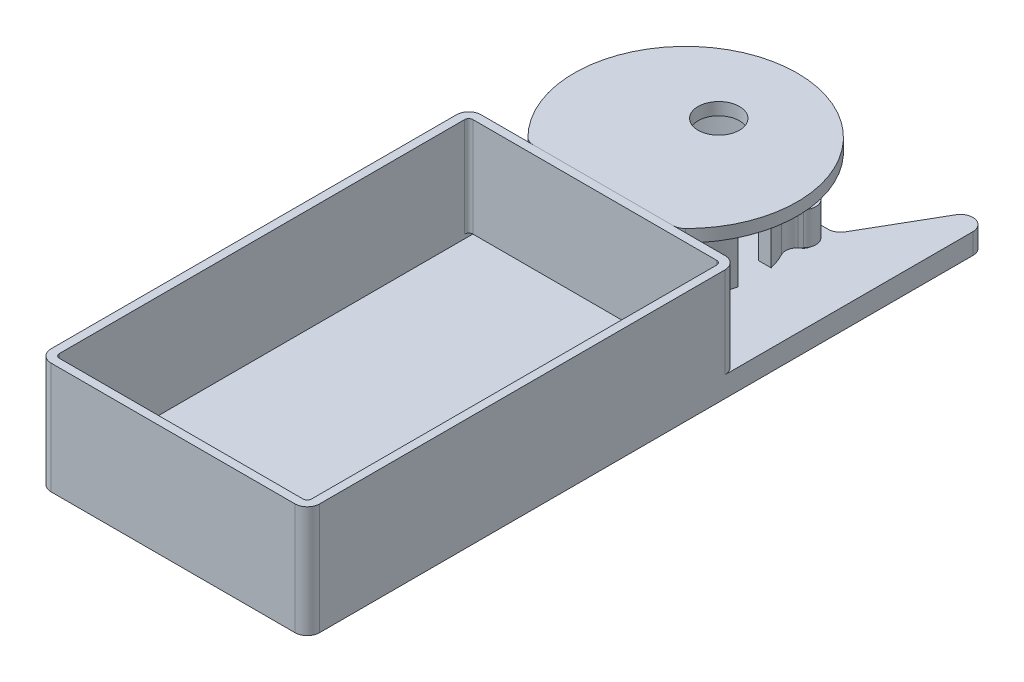
from build123d import *

# Parameters (mm, degrees)
SKETCH1_W                           = 75
SKETCH1_H                           = 3
EXTRUDE_THIN1_DEPTH                 = 37.5
SKETCH2_R                           = 17.15
SKETCH2_R_2                         = 14.15
EXTRUDE_THIN2_DEPTH                 = 18
CUT_EXTRUDE10_DEPTH                 = 57.004464108
CUT_EXTRUDE10_DEPTH_BACK            = 57.004464108
SKETCH28_W                          = 75
SKETCH28_H                          = 17.5
CUT_EXTRUDE1_DEPTH                  = 57.004464108
SKETCH5_R                           = 5
CUT_EXTRUDE2_DEPTH                  = 57.004464108
FILLET1_R                           = 2.5
SKETCH6_R                           = 1.75
BOSS_EXTRUDE2_DEPTH                 = 8
CIRPATTERN1_COUNT                   = 4
SKETCH7_R                           = 1.75
BOSS_EXTRUDE3_DEPTH                 = 5
FILLET2_R                           = 3
FILLET3_R                           = 3
FILLET4_R                           = 0.5
WE_RE_MAKING_IT_A_CIRCLE_DEPTH      = 60.510503275
WE_RE_MAKING_IT_A_CIRCLE_DEPTH_BACK = 60.510503275
CUT_EXTRUDE8_DEPTH                  = 18
BOSS_EXTRUDE4_START                 = -5
BOSS_EXTRUDE4_DEPTH                 = 5
SKETCH27_R                          = 3.5
CUT_EXTRUDE9_DEPTH                  = 2.2
SKETCH29_W                          = 65
SKETCH29_H                          = 104.076673866
BOSS_EXTRUDE5_DEPTH                 = 22
FILLET5_R                           = 3
FILLET6_R                           = 3
SHELL1_START                        = -22
SHELL1_DEPTH                        = 25
SHELL1_2_OUTLINE_R                  = 5.5
SHELL1_2_DEPTH                      = 1


# Read off the part's stored shape, not the designer's step: Shell1
with BuildPart() as part:
    # Sketch1 → Extrude-Thin1 (new, symmetric)
    with BuildSketch(Plane.XY):
        with Locations((0, 1.5)):
            Rectangle(SKETCH1_W, SKETCH1_H)
    extrude(amount=EXTRUDE_THIN1_DEPTH, both=True)

    # Sketch2 → Extrude-Thin2 (add)
    with BuildSketch(Plane.XZ):
        Circle(SKETCH2_R)
        Circle(SKETCH2_R_2, mode=Mode.SUBTRACT)
    extrude(amount=EXTRUDE_THIN2_DEPTH)

    # Sketch28 → Cut-Extrude10 (cut, two sides: drawn at the far end of the back side and taken through both)
    with BuildSketch(Plane.XZ.offset(-CUT_EXTRUDE10_DEPTH_BACK)):
        with Locations((0, 28.75)):
            Rectangle(SKETCH28_W, SKETCH28_H)
    extrude(amount=CUT_EXTRUDE10_DEPTH + CUT_EXTRUDE10_DEPTH_BACK, mode=Mode.SUBTRACT)

    # Sketch3 → Cut-Extrude1 (cut, through all)
    with BuildSketch(Plane.XZ):
        with BuildLine():
            ThreePointArc((17.15, 0), (17.031340786, 2.013934219), (16.677005127, 4))
            Line((16.677005127, 4), (13.572858947, 4))
            ThreePointArc((13.572858947, 4), (14.004971512, 2.020711001), (14.15, 0))
            ThreePointArc((14.15, 0), (14.004971512, -2.020711001), (13.572858947, -4))
            Line((13.572858947, -4), (16.677005127, -4))
            ThreePointArc((16.677005127, -4), (17.031340786, -2.013934219), (17.15, 0))
        make_face()
        with BuildLine():
            Line((-13.572858947, 4), (-16.677005127, 4))
            ThreePointArc((-16.677005127, 4), (-17.15, 0), (-16.677005127, -4))
            Line((-16.677005127, -4), (-13.572858947, -4))
            ThreePointArc((-13.572858947, -4), (-14.15, 0), (-13.572858947, 4))
        make_face()
        with BuildLine():
            ThreePointArc((17.15, 0), (17.031340786, 2.013934219), (16.677005127, 4))
            Line((16.677005127, 4), (13.572858947, 4))
            ThreePointArc((13.572858947, 4), (14.004971512, 2.020711001), (14.15, 0))
            ThreePointArc((14.15, 0), (14.004971512, -2.020711001), (13.572858947, -4))
            Line((13.572858947, -4), (16.677005127, -4))
            ThreePointArc((16.677005127, -4), (17.031340786, -2.013934219), (17.15, 0))
        make_face()
        with BuildLine():
            Line((-13.572858947, 4), (-16.677005127, 4))
            ThreePointArc((-16.677005127, 4), (-17.15, 0), (-16.677005127, -4))
            Line((-16.677005127, -4), (-13.572858947, -4))
            ThreePointArc((-13.572858947, -4), (-14.15, 0), (-13.572858947, 4))
        make_face()
        with BuildLine():
            Line((7.5, 11.998854112), (7.5, 15.423115768))
            ThreePointArc((7.5, 15.423115768), (0, 17.15), (-7.5, 15.423115768))
            Line((-7.5, 15.423115768), (-7.5, 11.998854112))
            ThreePointArc((-7.5, 11.998854112), (0, 14.15), (7.5, 11.998854112))
        make_face()
    extrude(amount=CUT_EXTRUDE1_DEPTH, mode=Mode.SUBTRACT)

    # Sketch5 → Cut-Extrude2 (cut, through all)
    with BuildSketch(Plane.XZ):
        with Locations((0, -8)):
            Circle(SKETCH5_R)
    extrude(amount=-CUT_EXTRUDE2_DEPTH, mode=Mode.SUBTRACT)

    # Fillet1
    # the kernel refuses this fillet: 2.5 mm, written as the material it adds along each edge
    with BuildSketch(Plane(origin=(0, 0, 0), x_dir=(0.9916815847711111, 0, -0.1287153231975797), z_dir=(-0.1287153231975797, 0, -0.9916815847711111))) as fillet1_piece_1_section:
        with BuildLine():
            CenterArc((17.15 + FILLET1_R, FILLET1_R), FILLET1_R, 180, 90)
            Line((17.15, FILLET1_R), (17.15, 0))
            Line((17.15, 0), (17.15 + FILLET1_R, 0))
        make_face()
    fillet1_piece_1 = revolve(axis=Axis((0, 0, 0), (0, -1, 0)), revolution_arc=92.345526819, mode=Mode.PRIVATE)
    fillet1_piece_1 = split(fillet1_piece_1, bisect_by=Plane(origin=(13.320196774, -0.548835021, 4), z_dir=(0, 0, 1)), keep=Keep.TOP, mode=Mode.PRIVATE)
    fillet1_piece_1 = split(fillet1_piece_1, bisect_by=Plane(origin=(7.5, -0.548835021, 10.7907154), z_dir=(1, 0, 0)), keep=Keep.TOP, mode=Mode.PRIVATE)
    add(fillet1_piece_1)
    with BuildSketch(Plane(origin=(0, 0, 0), x_dir=(-0.08802218906819527, 0, 0.9961185141496183), z_dir=(0.9961185141496183, 0, 0.08802218906819527))) as fillet1_piece_2_section:
        with BuildLine():
            CenterArc((17.15 + FILLET1_R, FILLET1_R), FILLET1_R, 180, 90)
            Line((17.15, FILLET1_R), (17.15, 0))
            Line((17.15, 0), (17.15 + FILLET1_R, 0))
        make_face()
    fillet1_piece_2 = revolve(axis=Axis((0, 0, 0), (0, -1, 0)), revolution_arc=92.345526819, mode=Mode.PRIVATE)
    fillet1_piece_2 = split(fillet1_piece_2, bisect_by=Plane(origin=(-7.5, -0.548834974, 10.790715008), z_dir=(-1, 0, 0)), keep=Keep.TOP, mode=Mode.PRIVATE)
    fillet1_piece_2 = split(fillet1_piece_2, bisect_by=Plane(origin=(-13.320197131, -0.548834974, 4), z_dir=(0, 0, 1)), keep=Keep.TOP, mode=Mode.PRIVATE)
    add(fillet1_piece_2)
    with BuildSketch(Plane(origin=(0, 0, 0), x_dir=(-0.9916329608415276, 0, 0.1290893914024917), z_dir=(0.1290893914024917, 0, 0.9916329608415276))) as fillet1_piece_3_section:
        with BuildLine():
            CenterArc((17.15 + FILLET1_R, FILLET1_R), FILLET1_R, 180, 90)
            Line((17.15, FILLET1_R), (17.15, 0))
            Line((17.15, 0), (17.15 + FILLET1_R, 0))
        make_face()
    fillet1_piece_3 = revolve(axis=Axis((0, 0, 0), (0, -1, 0)), revolution_arc=194.833949818, mode=Mode.PRIVATE)
    fillet1_piece_3 = split(fillet1_piece_3, bisect_by=Plane(origin=(0, -0.702302043, -4), z_dir=(0, 0, -1)), keep=Keep.TOP, mode=Mode.PRIVATE)
    add(fillet1_piece_3)

    # Sketch6 → Boss-Extrude2 (add)
    with BuildSketch(Plane(origin=(0, -10, 0), x_dir=(-1, 0, 0), z_dir=(0, -1, 0))):
        with BuildLine():
            Line((-16.369521984, 12.126881297), (-14.061221934, 9.818581247))
            ThreePointArc((-14.061221934, 9.818581247), (-12.126881297, 12.126881297), (-9.818581247, 14.061221934))
            Line((-9.818581247, 14.061221934), (-12.126881297, 16.369521984))
            ThreePointArc((-12.126881297, 16.369521984), (-16.369521984, 16.369521984), (-16.369521984, 12.126881297))
        make_face()
        with Locations(Location((-14.248201641, 14.248201641, 0), (0, 0, 180))):
            Circle(SKETCH6_R, mode=Mode.SUBTRACT)
    boss_extrude2 = extrude(amount=BOSS_EXTRUDE2_DEPTH)

    # CirPattern1: Boss-Extrude2 ×4 about axis
    cirpattern1_axis = Axis((0, 0, 0), (0, 1, 0))
    for i in range(1, CIRPATTERN1_COUNT):
        add(boss_extrude2.rotate(cirpattern1_axis, i * 360 / CIRPATTERN1_COUNT))

    # Fillet2
    fillet2_edges = [part.edges().sort_by_distance(p)[0] for p in [
        (9.818581247, -14, -14.061221934),
        (14.061221934, -14, -9.818581247),
        (14.061221934, -14, 9.818581247),
        (9.818581247, -14, 14.061221934),
        (-9.818581247, -14, 14.061221934),
        (-14.061221934, -14, 9.818581247),
        (-14.061221934, -14, -9.818581247),
        (-9.818581247, -14, -14.061221934),
    ]]
    fillet(fillet2_edges, radius=FILLET2_R)

    # Fillet4
    fillet4_edges = [part.edges().sort_by_distance(p)[0] for p in [
        (0, 0, -14.15),
        (-11.269949549, 0, 8.556327318),
        (11.269949549, 0, 8.556327318),
    ]]
    fillet(fillet4_edges, radius=FILLET4_R)

    # Sketch8 → We're making it a circle (cut, two sides: drawn at the far end of the back side and taken through both)
    with BuildSketch(Plane(origin=(0, 3, 0), x_dir=(1, 0, 0), z_dir=(0, 1, 0)).offset(-WE_RE_MAKING_IT_A_CIRCLE_DEPTH_BACK)):
        with BuildLine():
            ThreePointArc((-18.138357147, -20), (-10.937649588, 24.685376673), (27, 0))
            ThreePointArc((27, 0), (24.685376673, -10.937649588), (18.138357147, -20))
            Line((18.138357147, -20), (37.5, -20))
            Line((37.5, -20), (37.5, 37.5))
            Line((37.5, 37.5), (-37.5, 37.5))
            Line((-37.5, 37.5), (-37.5, -20))
            Line((-37.5, -20), (-18.138357147, -20))
        make_face()
    extrude(amount=WE_RE_MAKING_IT_A_CIRCLE_DEPTH + WE_RE_MAKING_IT_A_CIRCLE_DEPTH_BACK, mode=Mode.SUBTRACT)

    # Sketch21 → Cut-Extrude8 (cut)
    with BuildSketch(Plane.XZ.offset(18)):
        with BuildLine():
            Line((10, 9.290990259), (10, 12.290990259))
            ThreePointArc((10, 12.290990259), (0, 15.845139367), (-10, 12.290990259))
            Line((-10, 12.290990259), (-10, 9.290990259))
            ThreePointArc((-10, 9.290990259), (0, 13.65), (10, 9.290990259))
        make_face()
    extrude(amount=-CUT_EXTRUDE8_DEPTH, mode=Mode.SUBTRACT)

    # Fillet5
    fillet5_edges = [part.edges().sort_by_distance(p)[0] for p in [
        (18.138357147, 1.5, 20),
        (-18.138357147, 1.5, 20),
    ]]
    fillet(fillet5_edges, radius=FILLET5_R)


with BuildPart() as body_2:
    # Sketch7 → Boss-Extrude3 (new body)
    # profile 1 of 8: a face of its own
    with BuildSketch(Plane(origin=(0, -19, 0), x_dir=(-1, 0, 0), z_dir=(0, -1, 0))):
        with BuildLine():
            Line((13.572858947, 4), (16.677005127, 4))
            ThreePointArc((16.677005127, 4), (15.642046626, 7.031989573), (14.061221934, 9.818581247))
            ThreePointArc((14.061221934, 9.818581247), (12.126881297, 12.126881297), (9.818581247, 14.061221934))
            ThreePointArc((9.818581247, 14.061221934), (0, 17.15), (-9.818581247, 14.061221934))
            ThreePointArc((-9.818581247, 14.061221934), (-12.126881297, 12.126881297), (-14.061221934, 9.818581247))
            ThreePointArc((-14.061221934, 9.818581247), (-15.642046626, 7.031989573), (-16.677005127, 4))
            Line((-16.677005127, 4), (-13.572858947, 4))
            ThreePointArc((-13.572858947, 4), (0, 14.15), (13.572858947, 4))
        make_face()
    # profile 2 of 8: a face of its own
    with BuildSketch(Plane(origin=(0, -19, 0), x_dir=(-1, 0, 0), z_dir=(0, -1, 0))):
        with BuildLine():
            Line((-16.369521984, 12.126881297), (-14.061221934, 9.818581247))
            ThreePointArc((-14.061221934, 9.818581247), (-12.126881297, 12.126881297), (-9.818581247, 14.061221934))
            Line((-9.818581247, 14.061221934), (-12.126881297, 16.369521984))
            ThreePointArc((-12.126881297, 16.369521984), (-16.369521984, 16.369521984), (-16.369521984, 12.126881297))
        make_face()
        with Locations(Location((-14.248201641, 14.248201641, 0), (0, 0, 180))):
            Circle(SKETCH7_R, mode=Mode.SUBTRACT)
    # profile 3 of 8: a face of its own
    with BuildSketch(Plane(origin=(0, -19, 0), x_dir=(-1, 0, 0), z_dir=(0, -1, 0))):
        with BuildLine():
            ThreePointArc((9.818581247, 14.061221934), (12.126881297, 12.126881297), (14.061221934, 9.818581247))
            Line((14.061221934, 9.818581247), (16.369521984, 12.126881297))
            ThreePointArc((16.369521984, 12.126881297), (16.369521984, 16.369521984), (12.126881297, 16.369521984))
            Line((12.126881297, 16.369521984), (9.818581247, 14.061221934))
        make_face()
        with Locations(Location((14.248201641, 14.248201641, 0), (0, 0, 180))):
            Circle(SKETCH7_R, mode=Mode.SUBTRACT)
    # profile 4 of 8: a face of its own
    with BuildSketch(Plane(origin=(0, -19, 0), x_dir=(-1, 0, 0), z_dir=(0, -1, 0))):
        with BuildLine():
            ThreePointArc((7.5, -15.423115768), (8.686023417, -14.787680589), (9.818581247, -14.061221934))
            ThreePointArc((9.818581247, -14.061221934), (12.126881297, -12.126881297), (14.061221934, -9.818581247))
            ThreePointArc((14.061221934, -9.818581247), (15.642046626, -7.031989573), (16.677005127, -4))
            Line((16.677005127, -4), (13.572858947, -4))
            ThreePointArc((13.572858947, -4), (11.269949549, -8.556327318), (7.5, -11.998854112))
            Line((7.5, -11.998854112), (7.5, -15.423115768))
        make_face()
    # profile 5 of 8: a face of its own
    with BuildSketch(Plane(origin=(0, -19, 0), x_dir=(-1, 0, 0), z_dir=(0, -1, 0))):
        with BuildLine():
            ThreePointArc((14.061221934, -9.818581247), (12.126881297, -12.126881297), (9.818581247, -14.061221934))
            Line((9.818581247, -14.061221934), (12.126881297, -16.369521984))
            ThreePointArc((12.126881297, -16.369521984), (16.369521984, -16.369521984), (16.369521984, -12.126881297))
            Line((16.369521984, -12.126881297), (14.061221934, -9.818581247))
        make_face()
        with Locations(Location((14.248201641, -14.248201641, 0), (0, 0, 180))):
            Circle(SKETCH7_R, mode=Mode.SUBTRACT)
    # profile 6 of 8: a face of its own
    with BuildSketch(Plane(origin=(0, -19, 0), x_dir=(-1, 0, 0), z_dir=(0, -1, 0))):
        with BuildLine():
            ThreePointArc((-7.5, -15.423115768), (0, -17.15), (7.5, -15.423115768))
            Line((7.5, -15.423115768), (7.5, -11.998854112))
            ThreePointArc((7.5, -11.998854112), (11.269949549, -8.556327318), (13.572858947, -4))
            Line((13.572858947, -4), (16.677005127, -4))
            ThreePointArc((16.677005127, -4), (17.031340786, -2.013934219), (17.15, 0))
            ThreePointArc((17.15, 0), (17.031340786, 2.013934219), (16.677005127, 4))
            Line((16.677005127, 4), (13.572858947, 4))
            ThreePointArc((13.572858947, 4), (0, 14.15), (-13.572858947, 4))
            Line((-13.572858947, 4), (-16.677005127, 4))
            ThreePointArc((-16.677005127, 4), (-17.15, 0), (-16.677005127, -4))
            Line((-16.677005127, -4), (-13.572858947, -4))
            ThreePointArc((-13.572858947, -4), (-11.269949549, -8.556327318), (-7.5, -11.998854112))
            Line((-7.5, -11.998854112), (-7.5, -15.423115768))
        make_face()
    # profile 7 of 8: a face of its own
    with BuildSketch(Plane(origin=(0, -19, 0), x_dir=(-1, 0, 0), z_dir=(0, -1, 0))):
        with BuildLine():
            ThreePointArc((-9.818581247, -14.061221934), (-8.686023417, -14.787680589), (-7.5, -15.423115768))
            Line((-7.5, -15.423115768), (-7.5, -11.998854112))
            ThreePointArc((-7.5, -11.998854112), (-11.269949549, -8.556327318), (-13.572858947, -4))
            Line((-13.572858947, -4), (-16.677005127, -4))
            ThreePointArc((-16.677005127, -4), (-15.642046626, -7.031989573), (-14.061221934, -9.818581247))
            ThreePointArc((-14.061221934, -9.818581247), (-12.126881297, -12.126881297), (-9.818581247, -14.061221934))
        make_face()
    # profile 8 of 8: a face of its own
    with BuildSketch(Plane(origin=(0, -19, 0), x_dir=(-1, 0, 0), z_dir=(0, -1, 0))):
        with BuildLine():
            Line((-12.126881297, -16.369521984), (-9.818581247, -14.061221934))
            ThreePointArc((-9.818581247, -14.061221934), (-12.126881297, -12.126881297), (-14.061221934, -9.818581247))
            Line((-14.061221934, -9.818581247), (-16.369521984, -12.126881297))
            ThreePointArc((-16.369521984, -12.126881297), (-16.369521984, -16.369521984), (-12.126881297, -16.369521984))
        make_face()
        with Locations(Location((-14.248201641, -14.248201641, 0), (0, 0, 180))):
            Circle(SKETCH7_R, mode=Mode.SUBTRACT)
    extrude(amount=BOSS_EXTRUDE3_DEPTH)

    # Fillet3
    fillet3_edges = [body_2.edges().sort_by_distance(p)[0] for p in [
        (9.818581247, -21.5, 14.061221934),
        (14.061221934, -21.5, 9.818581247),
        (14.061221934, -21.5, -9.818581247),
        (9.818581247, -21.5, -14.061221934),
        (-9.818581247, -21.5, -14.061221934),
        (-14.061221934, -21.5, -9.818581247),
        (-14.061221934, -21.5, 9.818581247),
        (-9.818581247, -21.5, 14.061221934),
    ]]
    fillet(fillet3_edges, radius=FILLET3_R)

    # Sketch24 → Boss-Extrude4 (add)
    with BuildSketch(Plane.XZ.offset(24).offset(BOSS_EXTRUDE4_START)):
        with BuildLine():
            Line((-32.5, 124.076673866), (-32.5, 24.076673866))
            Line((-32.5, 24.076673866), (-32.5, 0))
            Line((-32.5, 0), (-32.5, -37))
            ThreePointArc((-32.5, -37), (-30.276457135, -39.897777479), (-26.901923789, -38.5))
            Line((-26.901923789, -38.5), (-17.086969212, -21.5))
            ThreePointArc((-17.086969212, -21.5), (-15.988893001, -20.401923789), (-14.488893001, -20))
            Line((-14.488893001, -20), (-0.569378841, -20))
            Line((-0.569378841, -20), (0.569378841, -20))
            Line((0.569378841, -20), (14.488893001, -20))
            ThreePointArc((14.488893001, -20), (15.988893001, -20.401923789), (17.086969212, -21.5))
            Line((17.086969212, -21.5), (26.901923789, -38.5))
            ThreePointArc((26.901923789, -38.5), (30.276457135, -39.897777479), (32.5, -37))
            Line((32.5, -37), (32.5, 0))
            Line((32.5, 0), (32.5, 24.076673866))
            Line((32.5, 24.076673866), (32.5, 124.076673866))
            Line((32.5, 124.076673866), (-32.5, 124.076673866))
        make_face()
        with BuildLine():
            ThreePointArc((-7.965807636, 15.187771684), (0, 17.15), (7.965807636, 15.187771684))
            ThreePointArc((7.965807636, 15.187771684), (9.811046483, 14.87874088), (11.480563717, 15.723204404))
            Line((11.480563717, 15.723204404), (12.126881297, 16.369521984))
            ThreePointArc((12.126881297, 16.369521984), (16.369521984, 16.369521984), (16.369521984, 12.126881297))
            Line((16.369521984, 12.126881297), (15.723204404, 11.480563717))
            ThreePointArc((15.723204404, 11.480563717), (14.87874088, 9.811046483), (15.187771684, 7.965807636))
            ThreePointArc((15.187771684, 7.965807636), (17.15, 0), (15.187771684, -7.965807636))
            ThreePointArc((15.187771684, -7.965807636), (14.87874088, -9.811046483), (15.723204404, -11.480563717))
            Line((15.723204404, -11.480563717), (16.369521984, -12.126881297))
            ThreePointArc((16.369521984, -12.126881297), (16.369521984, -16.369521984), (12.126881297, -16.369521984))
            Line((12.126881297, -16.369521984), (11.480563717, -15.723204404))
            ThreePointArc((11.480563717, -15.723204404), (9.811046483, -14.87874088), (7.965807636, -15.187771684))
            ThreePointArc((7.965807636, -15.187771684), (0, -17.15), (-7.965807636, -15.187771684))
            ThreePointArc((-7.965807636, -15.187771684), (-9.811046483, -14.87874088), (-11.480563717, -15.723204404))
            Line((-11.480563717, -15.723204404), (-12.126881297, -16.369521984))
            ThreePointArc((-12.126881297, -16.369521984), (-16.369521984, -16.369521984), (-16.369521984, -12.126881297))
            Line((-16.369521984, -12.126881297), (-15.723204404, -11.480563717))
            ThreePointArc((-15.723204404, -11.480563717), (-14.87874088, -9.811046483), (-15.187771684, -7.965807636))
            ThreePointArc((-15.187771684, -7.965807636), (-17.15, 0), (-15.187771684, 7.965807636))
            ThreePointArc((-15.187771684, 7.965807636), (-14.87874088, 9.811046483), (-15.723204404, 11.480563717))
            Line((-15.723204404, 11.480563717), (-16.369521984, 12.126881297))
            ThreePointArc((-16.369521984, 12.126881297), (-16.369521984, 16.369521984), (-12.126881297, 16.369521984))
            Line((-12.126881297, 16.369521984), (-11.480563717, 15.723204404))
            ThreePointArc((-11.480563717, 15.723204404), (-9.811046483, 14.87874088), (-7.965807636, 15.187771684))
        make_face(mode=Mode.SUBTRACT)
    extrude(amount=BOSS_EXTRUDE4_DEPTH)

    # Sketch27 → Cut-Extrude9 (cut)
    with BuildSketch(Plane.XZ.offset(24)):
        with Locations((-14.248201641, 14.248201641)):
            Circle(SKETCH27_R)
        with Locations((14.248201641, 14.248201641)):
            Circle(SKETCH27_R)
        with Locations((14.248201641, -14.248201641)):
            Circle(SKETCH27_R)
        with Locations((-14.248201641, -14.248201641)):
            Circle(SKETCH27_R)
    extrude(amount=-CUT_EXTRUDE9_DEPTH, mode=Mode.SUBTRACT)

    # Sketch29 → Boss-Extrude5 (add)
    with BuildSketch(Plane(origin=(0, -19, 0), x_dir=(1, 0, 0), z_dir=(0, 1, 0))):
        with Locations((0, -72.038336933)):
            Rectangle(SKETCH29_W, SKETCH29_H)
    extrude(amount=BOSS_EXTRUDE5_DEPTH)

    # Fillet6
    fillet6_edges = [body_2.edges().sort_by_distance(p)[0] for p in [
        (32.5, -10.5, 124.076673866),
        (-32.5, -10.5, 124.076673866),
        (32.5, -8, 20),
        (-32.5, -8, 20),
    ]]
    fillet(fillet6_edges, radius=FILLET6_R)

    # Shell1 outline → Shell1 (cut)
    with BuildSketch(Plane(origin=(0, 0, 0), x_dir=(1, 0, 0), z_dir=(0, 1, 0)).offset(SHELL1_START)):
        with BuildLine():
            Line((30.5, -121.076673866), (30.5, -23))
            ThreePointArc((30.5, -23), (30.207106781, -22.292893219), (29.5, -22))
            Line((29.5, -22), (-29.5, -22))
            ThreePointArc((-29.5, -22), (-30.207106781, -22.292893219), (-30.5, -23))
            Line((-30.5, -23), (-30.5, -121.076673866))
            ThreePointArc((-30.5, -121.076673866), (-30.207106781, -121.783780647), (-29.5, -122.076673866))
            Line((-29.5, -122.076673866), (29.5, -122.076673866))
            ThreePointArc((29.5, -122.076673866), (30.207106781, -121.783780647), (30.5, -121.076673866))
        make_face()
    extrude(amount=SHELL1_DEPTH, mode=Mode.SUBTRACT)

    # Shell1 2 outline → Shell1 2 (cut)
    with BuildSketch(Plane(origin=(0, 0, 0), x_dir=(1, 0, 0), z_dir=(0, 1, 0)).offset(SHELL1_START)):
        with BuildLine():
            Line((30.5, -23), (30.5, 37))
            ThreePointArc((30.5, 37), (29.758819045, 37.965925826), (28.633974596, 37.5))
            Line((28.633974596, 37.5), (18.81902002, 20.5))
            ThreePointArc((18.81902002, 20.5), (18.139206232, 19.583098873), (17.269159369, 18.844266741))
            ThreePointArc((17.269159369, 18.844266741), (14.902849646, 8.787300984), (10.226509326, 18))
            Line((10.226509326, 18), (-10.226509326, 18))
            ThreePointArc((-10.226509326, 18), (-14.902849646, 8.787300984), (-17.269159369, 18.844266741))
            ThreePointArc((-17.269159369, 18.844266741), (-18.139206232, 19.583098873), (-18.81902002, 20.5))
            Line((-18.81902002, 20.5), (-28.633974596, 37.5))
            ThreePointArc((-28.633974596, 37.5), (-29.758819045, 37.965925826), (-30.5, 37))
            Line((-30.5, 37), (-30.5, -23))
            ThreePointArc((-30.5, -23), (-30.207106781, -22.292893219), (-29.5, -22))
            Line((-29.5, -22), (29.5, -22))
            ThreePointArc((29.5, -22), (30.207106781, -22.292893219), (30.5, -23))
        make_face()
        with Locations((-14.248201641, -14.248201641)):
            Circle(SHELL1_2_OUTLINE_R, mode=Mode.SUBTRACT)
        with Locations((14.248201641, -14.248201641)):
            Circle(SHELL1_2_OUTLINE_R, mode=Mode.SUBTRACT)
    extrude(amount=SHELL1_2_DEPTH, mode=Mode.SUBTRACT)


solid = Compound([part.part, body_2.part])
